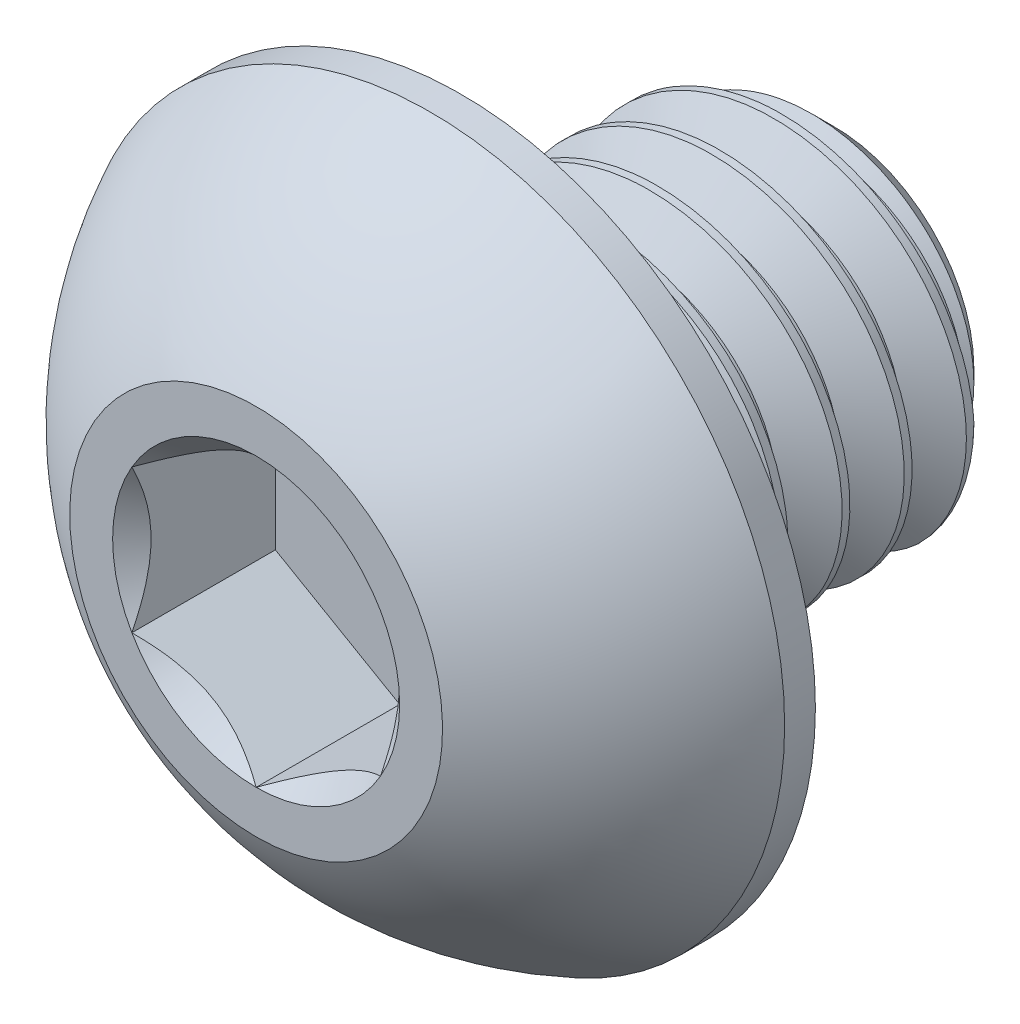
from build123d import *

# Parameters (mm, degrees)
CUT_EXTRUDE2_DEPTH = 1.155
CUT_SWEEP2_PITCH   = 0.5


# Read off the part's stored shape, not the designer's step: Split1
with BuildPart() as part:
    # Sketch10 → Revolve3 (revolve)
    with BuildSketch(Plane(origin=(0, 0, 0), x_dir=(0, 0, -1), z_dir=(1, 0, 0)), mode=Mode.PRIVATE) as revolve3_sk:
        Polygon((4.275, 1.5), (4.65, 1.125), (4.65, 0), (1.65, 0), (1.65, 1.5), align=None)
    revolve(revolve3_sk.sketch.rotate(Axis((0, 0, 0), (0, 0, -1)), 90), axis=Axis((0, 0, 0), (0, 0, -1)))

    # Sketch7 → Revolve2 (revolve)
    with BuildSketch(Plane(origin=(0, 0, 0), x_dir=(0, 0, -1), z_dir=(1, 0, 0)), mode=Mode.PRIVATE) as revolve2_sk:
        with BuildLine():
            Line((1.4025, 2.85), (1.65, 2.85))
            Line((1.65, 2.85), (1.65, 0))
            Line((1.65, 0), (0, 0))
            Line((0, 0), (0, 1.5))
            ThreePointArc((0, 1.5), (0.59512511, 2.285251969), (1.4025, 2.85))
        make_face()
    revolve(revolve2_sk.sketch.rotate(Axis((0, 0, 0), (0, 0, -1)), 180), axis=Axis((0, 0, 0), (0, 0, -1)))

    # Sketch5 → Cut-Extrude2 (cut)
    with BuildSketch(Plane.XY):
        Polygon((1, -0.577350269), (1, 0.577350269), (0, 1.154700538), (-1, 0.577350269), (-1, -0.577350269), (0, -1.154700538), align=None)
    extrude(amount=-CUT_EXTRUDE2_DEPTH, mode=Mode.SUBTRACT)

    # Cut-Extrude3 cone 1 section (through the dimple's axis) → Cut-Extrude3 (revolve, cut)
    with BuildSketch(Plane(origin=(0, 0, 0), x_dir=(0, -1, 0), z_dir=(1, 0, 0))):
        Polygon((0, 0), (1.154700538, 0), (0, 1.154700538), align=None)
    revolve(axis=Axis((0, 0, 0), (0, 0, -1)), mode=Mode.SUBTRACT)


with BuildPart() as body_2:
    # Split1: the piece on the far side of the plane
    add(part.part)
    split(bisect_by=Plane.XY.offset(-1.65), keep=Keep.BOTTOM)

    # Cut-Sweep2: the profile of Sketch12 screwed along a right-hand helix of 9.3 turns, 6 arcs to a turn; built about Z, then put on its axis
    cut_sweep2_z = Axis((0, 0, 0), (0, 0, 1))
    cut_sweep2_corners = [(1.175240474, 0, -0.1875), (1.175240474, 0, -0.25), (1.527063294, 0, -0.453125), (1.527063294, 0, 0.015625)]
    with BuildLine(mode=Mode.PRIVATE) as cut_sweep2_profile:
        Line(cut_sweep2_corners[0], cut_sweep2_corners[1])
        Line(cut_sweep2_corners[1], cut_sweep2_corners[2])
        Line(cut_sweep2_corners[2], cut_sweep2_corners[3])
        Line(cut_sweep2_corners[3], cut_sweep2_corners[0])
    cut_sweep2_cap = Face(cut_sweep2_profile.wire())
    cut_sweep2_turn_angles = [0, 30, 60, 90, 120, 150, 180, 210, 240, 270, 300, 330, 360]
    cut_sweep2_turn_weights = [1, 0.8660254037844387, 1, 0.8660254037844387, 1, 0.8660254037844387, 1, 0.8660254037844387, 1, 0.8660254037844387, 1, 0.8660254037844387, 1]
    cut_sweep2_turn_rails = [Edge.make_bspline([Vector(p[0], p[1], 0).rotate(cut_sweep2_z, cut_sweep2_turn_angles[k]) / cut_sweep2_turn_weights[k] + Vector(0, 0, p[2] + CUT_SWEEP2_PITCH * cut_sweep2_turn_angles[k] / 360) for k in range(13)], [0, 0, 0, 1, 1, 2, 2, 3, 3, 4, 4, 5, 5, 6, 6, 6], 2, cut_sweep2_turn_weights) for p in cut_sweep2_corners]
    cut_sweep2_turn_sides = [Face.make_surface_from_curves(cut_sweep2_turn_rails[p[0]], cut_sweep2_turn_rails[p[1]]) for p in [(0, 1), (1, 2), (2, 3), (3, 0)]]
    cut_sweep2_last_angles = [3240, 3270, 3300, 3324, 3348]
    cut_sweep2_last_weights = [1, 0.8660254037844387, 1, 0.913545457642646, 1]
    cut_sweep2_last_rails = [Edge.make_bspline([Vector(p[0], p[1], 0).rotate(cut_sweep2_z, cut_sweep2_last_angles[k]) / cut_sweep2_last_weights[k] + Vector(0, 0, p[2] + CUT_SWEEP2_PITCH * cut_sweep2_last_angles[k] / 360) for k in range(5)], [0, 0, 0, 1, 1, 2, 2, 2], 2, cut_sweep2_last_weights) for p in cut_sweep2_corners]
    cut_sweep2_last_sides = [Face.make_surface_from_curves(cut_sweep2_last_rails[p[0]], cut_sweep2_last_rails[p[1]]) for p in [(0, 1), (1, 2), (2, 3), (3, 0)]]
    cut_sweep2 = Plane(origin=(0, 0, -4.65), x_dir=(0, 1, 0), z_dir=(0, 0, 1)) * Solid(Shell([*[p.moved(Location((0, 0, CUT_SWEEP2_PITCH * i))) for i in range(9) for p in cut_sweep2_turn_sides], *cut_sweep2_last_sides, cut_sweep2_cap, cut_sweep2_cap.rotate(cut_sweep2_z, 3348).moved(Location((0, 0, CUT_SWEEP2_PITCH * 3348 / 360)))]))
    add(cut_sweep2, mode=Mode.SUBTRACT)


with BuildPart() as part_1:
    add(part.part)

    # Split1
    split(bisect_by=Plane.XY.offset(-1.65), keep=Keep.TOP)

    add(body_2.part)  # Boss-Extrude1 merges body 2
    # Boss-Extrude1 cone 1 section (through the dimple's axis) → Boss-Extrude1 (revolve)
    with BuildSketch(Plane(origin=(0, 0, -1.65), x_dir=(0, -1, 0), z_dir=(1, 0, 0))):
        Polygon((0, 0), (1.5, 0), (0, 1.5), align=None)
    revolve(axis=Axis((0, 0, -1.65), (0, 0, -1)))


solid = part_1.part
